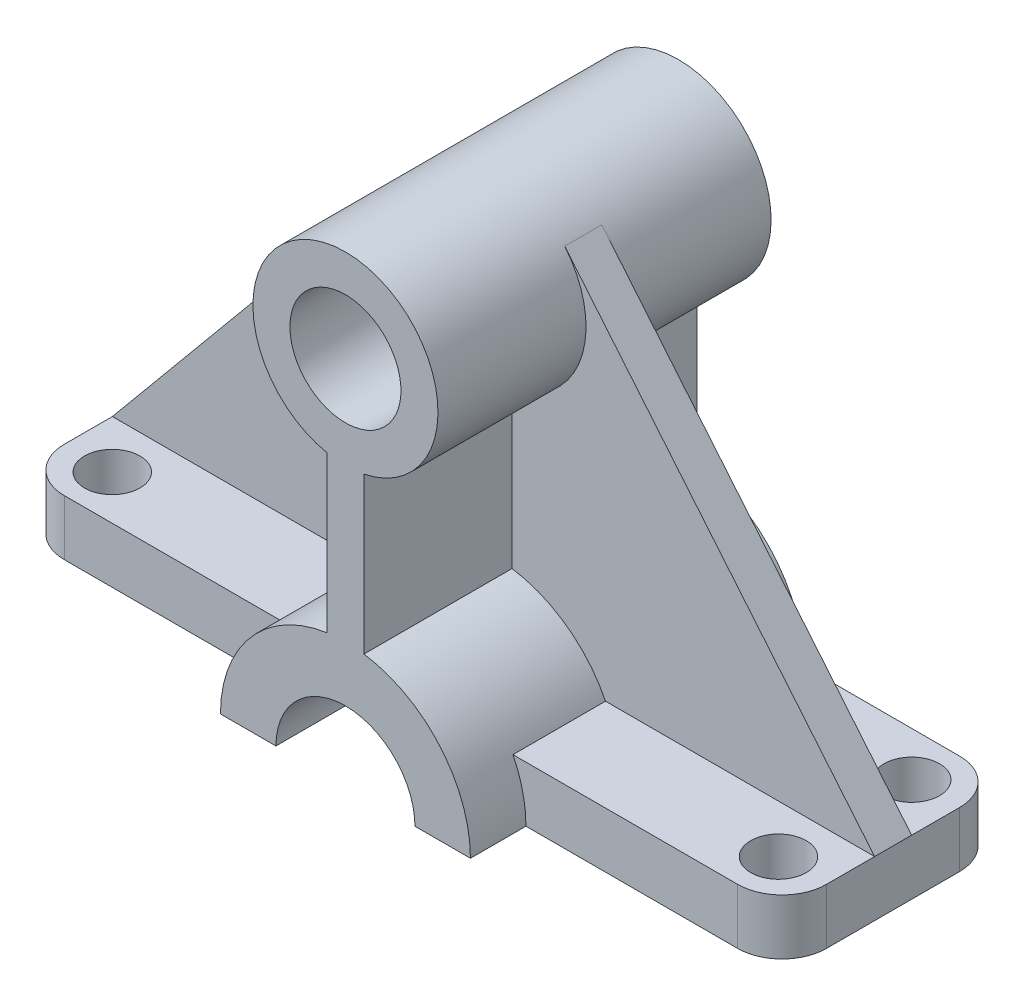
from build123d import *
from build123d.topology import SkipClean

# Parameters (mm, degrees)
SKETCH1_R           = 15
BOSS_EXTRUDE1_DEPTH = 45
SKETCH4_R           = 7.5
BOSS_EXTRUDE2_DEPTH = 15
CUT_EXTRUDE1_DEPTH  = 179.469413089
BOSS_EXTRUDE3_DEPTH = 5


with BuildPart() as part:
    # Sketch1 → Boss-Extrude1 (new, symmetric)
    with BuildSketch(Plane.XY):
        with BuildLine():
            ThreePointArc((-5, 33.400370285), (-25.587569792, 22.042255042), (-33.772544103, 0))
            Line((-33.772544103, 0), (-18.781429719, 0))
            ThreePointArc((-18.781429719, 0), (0, 18.781429719), (18.781429719, 0))
            Line((18.781429719, 0), (33.772544103, 0))
            ThreePointArc((33.772544103, 0), (25.587569792, 22.042255042), (5, 33.400370285))
            Line((5, 33.400370285), (5, 75.505102572))
            ThreePointArc((5, 75.505102572), (0, 125), (-5, 75.505102572))
            Line((-5, 75.505102572), (-5, 33.400370285))
        make_face()
        with Locations((0, 100)):
            Circle(SKETCH1_R, mode=Mode.SUBTRACT)
    extrude(amount=BOSS_EXTRUDE1_DEPTH, both=True)

    # Sketch4 → Boss-Extrude2 (add)
    with BuildSketch(Plane(origin=(0, 0, 0), x_dir=(1, 0, 0), z_dir=(0, 1, 0))):
        with BuildLine():
            Line((-90.962767097, -30), (90.962767097, -30))
            ThreePointArc((90.962767097, -30), (99.448048472, -26.485281374), (102.962767097, -18))
            Line((102.962767097, -18), (102.962767097, 18))
            ThreePointArc((102.962767097, 18), (99.448048472, 26.485281374), (90.962767097, 30))
            Line((90.962767097, 30), (-90.962767097, 30))
            ThreePointArc((-90.962767097, 30), (-99.448048472, 26.485281374), (-102.962767097, 18))
            Line((-102.962767097, 18), (-102.962767097, -18))
            ThreePointArc((-102.962767097, -18), (-99.448048472, -26.485281374), (-90.962767097, -30))
        make_face()
        with Locations((-90, 18)):
            Circle(SKETCH4_R, mode=Mode.SUBTRACT)
        with Locations((90, 18)):
            Circle(SKETCH4_R, mode=Mode.SUBTRACT)
        with Locations((90, -18)):
            Circle(SKETCH4_R, mode=Mode.SUBTRACT)
        with Locations((-90, -18)):
            Circle(SKETCH4_R, mode=Mode.SUBTRACT)
    extrude(amount=BOSS_EXTRUDE2_DEPTH)

    # Sketch5 → Cut-Extrude1 (cut, through all)
    with SkipClean():  # the faces are left unmerged after this step: merging them gives an invalid solid
        with BuildSketch(Plane.XY.offset(30)):
            with BuildLine():
                Line((-18.781429719, 0), (18.781429719, 0))
                ThreePointArc((18.781429719, 0), (16.807967644, 8.380592221), (11.302305177, 15))
                Line((11.302305177, 15), (-11.302305177, 15))
                ThreePointArc((-11.302305177, 15), (-16.807967644, 8.380592221), (-18.781429719, 0))
            make_face()
        extrude(amount=-CUT_EXTRUDE1_DEPTH, mode=Mode.SUBTRACT)
    add(part.part.scale(1), mode=Mode.REPLACE)  # the faces are merged on a copy

    # Sketch6 → Boss-Extrude3 (add, symmetric)
    with SkipClean():  # the faces are left unmerged after this step: merging them gives an invalid solid
        with BuildSketch(Plane.XY):
            with BuildLine():
                ThreePointArc((-5, 75.505102572), (-23.580846559, 91.696767162), (-19.244209313, 115.95808284))
                Line((-19.244209313, 115.95808284), (-102.962767097, 15))
                Line((-102.962767097, 15), (-30.258630755, 15))
                ThreePointArc((-30.258630755, 15), (-19.885576867, 27.297409545), (-5, 33.400370285))
                Line((-5, 33.400370285), (-5, 75.505102572))
            make_face()
            with BuildLine():
                Line((102.962767097, 15), (19.244209313, 115.95808284))
                ThreePointArc((19.244209313, 115.95808284), (23.580846559, 91.696767162), (5, 75.505102572))
                Line((5, 75.505102572), (5, 33.400370285))
                ThreePointArc((5, 33.400370285), (19.885576867, 27.297409545), (30.258630755, 15))
                Line((30.258630755, 15), (102.962767097, 15))
            make_face()
        extrude(amount=BOSS_EXTRUDE3_DEPTH, both=True)


solid = part.part
